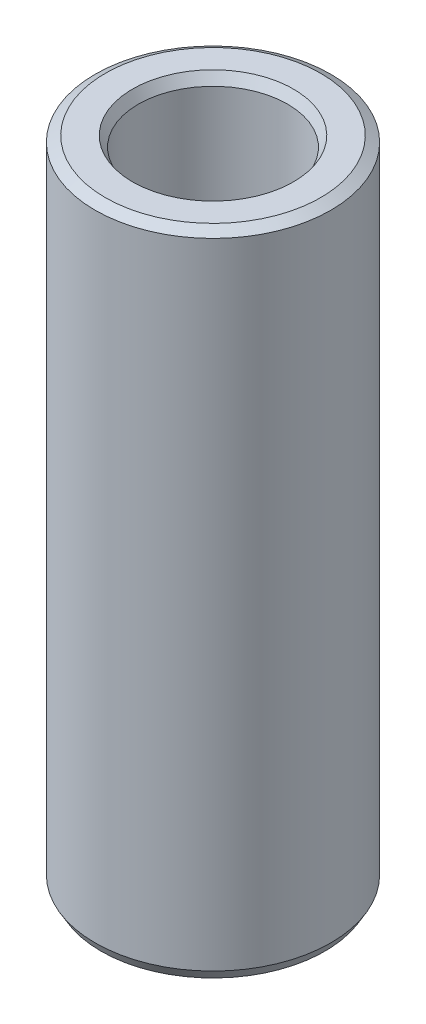
from build123d import *
from OCP.BRepFilletAPI import BRepFilletAPI_MakeChamfer

# Parameters (mm, degrees)
SKETCH1_R           = 10
BOSS_EXTRUDE1_DEPTH = 55.197825389
SKETCH2_R           = 6.330542314
CUT_EXTRUDE1_DEPTH  = 57.980697852
CHAMFER1_SIZE       = 0.497256912
CHAMFER1_SIZE2      = 0.861274236


with BuildPart() as part:
    # Sketch1 → Boss-Extrude1 (new body)
    with BuildSketch(Plane(origin=(0, 0, 0), x_dir=(1, 0, 0), z_dir=(0, 1, 0))):
        Circle(SKETCH1_R)
    extrude(amount=BOSS_EXTRUDE1_DEPTH)

    # Sketch2 → Cut-Extrude1 (cut, through all)
    with BuildSketch(Plane(origin=(0, 0, 0), x_dir=(1, 0, 0), z_dir=(0, 1, 0))):
        Circle(SKETCH2_R)
    extrude(amount=CUT_EXTRUDE1_DEPTH, mode=Mode.SUBTRACT)

    # Chamfer1: one chamfer whose edges measure the first distance from different faces: ONE call of the kernel's chamfer builder (chamfer() names one face for all edges)
    chamfer1_edges_1 = [part.edges().sort_by_distance(p)[0] for p in [
        (-6.330542314, 55.197825389, 0),
    ]]
    chamfer1_side_1 = [part.faces().sort_by_distance(p)[0] for p in [
        (-9.717157288, 55.197825389, 0),
    ]]
    chamfer1_edges_2 = [part.edges().sort_by_distance(p)[0] for p in [
        (-6.330542314, 0, 0),
    ]]
    chamfer1_side_2 = [part.faces().sort_by_distance(p)[0] for p in [
        (-6.330542314, 27.598912695, 0),
    ]]
    chamfer1_edges_3 = [part.edges().sort_by_distance(p)[0] for p in [
        (-10, 0, 0),
    ]]
    chamfer1_side_3 = [part.faces().sort_by_distance(p)[0] for p in [
        (-9.717157288, 0, 0),
    ]]
    chamfer1_edges_4 = [part.edges().sort_by_distance(p)[0] for p in [
        (-10, 55.197825389, 0),
    ]]
    chamfer1_side_4 = [part.faces().sort_by_distance(p)[0] for p in [
        (-10, 27.598912695, 0),
    ]]
    chamfer1 = BRepFilletAPI_MakeChamfer(part.part.solid().wrapped)
    for e in chamfer1_edges_1:
        chamfer1.Add(CHAMFER1_SIZE, CHAMFER1_SIZE2, e.wrapped, chamfer1_side_1[0].wrapped)  # the first distance lies on this face
    for e in chamfer1_edges_2:
        chamfer1.Add(CHAMFER1_SIZE, CHAMFER1_SIZE2, e.wrapped, chamfer1_side_2[0].wrapped)  # the first distance lies on this face
    for e in chamfer1_edges_3:
        chamfer1.Add(CHAMFER1_SIZE, CHAMFER1_SIZE2, e.wrapped, chamfer1_side_3[0].wrapped)  # the first distance lies on this face
    for e in chamfer1_edges_4:
        chamfer1.Add(CHAMFER1_SIZE, CHAMFER1_SIZE2, e.wrapped, chamfer1_side_4[0].wrapped)  # the first distance lies on this face
    add(Compound.cast(chamfer1.Shape()), mode=Mode.REPLACE)


solid = part.part
